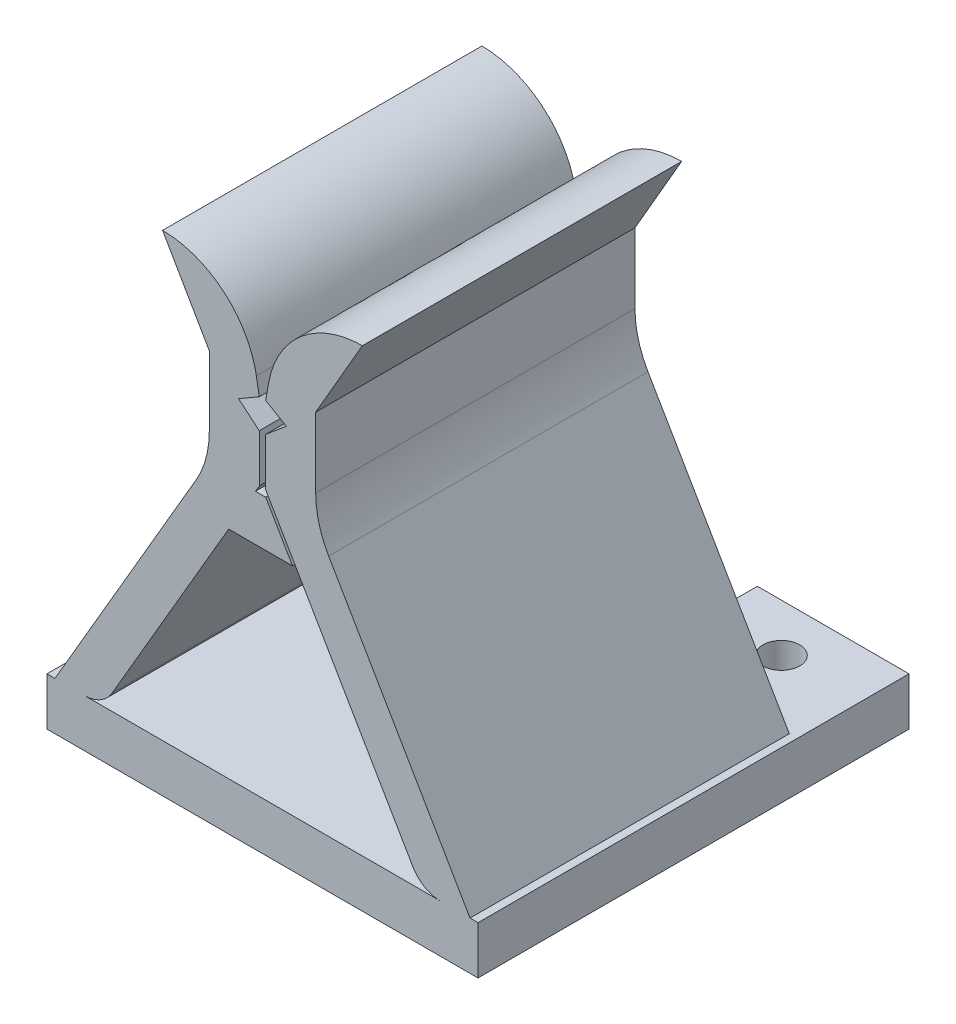
from build123d import *

# Parameters (mm, degrees)
SCHIZZO1_W                     = 50
SCHIZZO1_H                     = 3
ESTRUSIONE_ESTRUSIONE1_DEPTH   = 20
ESTRUSIONE_ESTRUSIONE2_DEPTH   = 20
ESTRUSIONE_ESTRUSIONE2_2_DEPTH = 20
RACCORDO2_R                    = 6
RACCORDO3_DEPTH                = 20
RACCORDO4_R                    = 6
RACCORDO5_R                    = 6
RACCORDO7_R                    = 2
RACCORDO8_R                    = 2
SCHIZZO5_W                     = 11.5
SCHIZZO5_H                     = 20
TAGLIO_ESTRUSIONE2_DEPTH       = 3
ESTRUSIONE_ESTRUSIONE7_DEPTH   = 20
SCHIZZO12_R                    = 1.15
ESTRUSIONE_ESTRUSIONE9_DEPTH   = 3
TAGLIO_ESTRUSIONE4_DEPTH       = 52.461506674
TAGLIO_ESTRUSIONE4_DEPTH_BACK  = 52.461506674


with BuildPart() as part:
    # Schizzo1 → Estrusione-Estrusione1 (new body)
    with BuildSketch(Plane.XY):
        with Locations((25, 1.5)):
            Rectangle(SCHIZZO1_W, SCHIZZO1_H)
    extrude(amount=ESTRUSIONE_ESTRUSIONE1_DEPTH)

    # Schizzo5 → Taglio-Estrusione2 (cut)
    with BuildSketch(Plane(origin=(0, 3, 0), x_dir=(1, 0, 0), z_dir=(0, 1, 0))):
        with Locations((5.75, -10)):
            Rectangle(SCHIZZO5_W, SCHIZZO5_H)
        with Locations((44.25, -10)):
            Rectangle(SCHIZZO5_W, SCHIZZO5_H)
    extrude(amount=-TAGLIO_ESTRUSIONE2_DEPTH, mode=Mode.SUBTRACT)



with BuildPart() as body_2:
    # Schizzo2 → Estrusione-Estrusione2 (new body)
    with BuildSketch(Plane.XY.offset(20)):
        Polygon((12, 3), (21.667680152, 19.610006491), (21.667680152, 25.610006491), (18.742038116, 30.677367142), (23.742038116, 30.677367142), (24.8, 24.677367142), (23.500961894, 23.927367142), (24.8, 22.837344747), (24.8, 19.837344747), (15, 3), align=None)
    extrude(amount=-ESTRUSIONE_ESTRUSIONE2_DEPTH)

    # Raccordo2
    # the kernel refuses this fillet: 6 mm, written as the material it takes off along each edge
    with BuildSketch(Plane(origin=(23.742038116, 30.677367142, 32.586494468), x_dir=(-1, 0, 0), z_dir=(0, 0, -1))) as raccordo2_piece_1:
        with BuildLine():
            CenterArc((RACCORDO2_R * 0.839099631177, -RACCORDO2_R), RACCORDO2_R, 90, 80)
            Line((-RACCORDO2_R * 0.145708121835, -RACCORDO2_R * 0.826351822333), (0, 0))
            Line((0, 0), (RACCORDO2_R * 0.839099631177, 0))
        make_face()
    extrude(amount=45.172988935, mode=Mode.SUBTRACT)

    # Raccordo5
    raccordo5_edges = [body_2.edges().sort_by_distance(p)[0] for p in [
        (21.667680152, 19.610006491, 10),
    ]]
    fillet(raccordo5_edges, radius=RACCORDO5_R)

    # Raccordo8
    raccordo8_edges = [body_2.edges().sort_by_distance(p)[0] for p in [
        (15, 3, 10),
    ]]
    fillet(raccordo8_edges, radius=RACCORDO8_R)

    # Schizzo9 → Estrusione-Estrusione7 (add)
    with BuildSketch(Plane.XY.offset(20)):
        Polygon((24.564100135, 19.432046037), (22.884294771, 16.545978484), (26.884294771, 16.545978484), (25.204489408, 19.432046037), align=None)
    extrude(amount=-ESTRUSIONE_ESTRUSIONE7_DEPTH)


with BuildPart() as body_3:
    # Schizzo2 → Estrusione-Estrusione2 2 (new body)
    with BuildSketch(Plane.XY.offset(20)):
        Polygon((26.499038106, 23.927367142), (25.2, 22.837344747), (25.2, 19.837344747), (35, 3), (38, 3), (28.332319848, 19.610006491), (28.332319848, 25.610006491), (31.257961884, 30.677367142), (26.257961884, 30.677367142), (25.2, 24.677367142), align=None)
    extrude(amount=-ESTRUSIONE_ESTRUSIONE2_2_DEPTH)

    # Raccordo3: read off the stored shape, not the designer's step
    # Raccordo3 outline → Raccordo3 (cut)
    with BuildSketch(Plane.XY):
        with BuildLine():
            add(Edge.make_bspline(
                [(31.257961884, 30.677367142), (26.252870263, 30.648491125), (25.38373076, 25.719356061)],
                knots=[0, 0, 0, 1, 1, 1], degree=2, weights=[1, 0.767895459, 1]))
            Line((31.257961884, 30.677367142), (26.257961884, 30.677367142))
            Line((26.257961884, 30.677367142), (25.38373076, 25.719356061))
        make_face()
    extrude(amount=RACCORDO3_DEPTH, mode=Mode.SUBTRACT)

    # Raccordo4
    raccordo4_edges = [body_3.edges().sort_by_distance(p)[0] for p in [
        (28.332319848, 19.610006491, 10),
    ]]
    fillet(raccordo4_edges, radius=RACCORDO4_R)

    # Raccordo7
    raccordo7_edges = [body_3.edges().sort_by_distance(p)[0] for p in [
        (35, 3, 10),
    ]]
    fillet(raccordo7_edges, radius=RACCORDO7_R)


with BuildPart() as part_1:
    add(part.part)

    add(body_2.part)  # Estrusione-Estrusione9 merges body 2

    add(body_3.part)  # Estrusione-Estrusione9 merges body 3
    # Schizzo12 → Estrusione-Estrusione9 (add)
    with BuildSketch(Plane(origin=(0, 3, 0), x_dir=(1, 0, 0), z_dir=(0, 1, 0))):
        Polygon((11.5, 0), (38.5, 0), (38.5, 7), (29, 7), (21, 7), (11.5, 7), align=None)
        with Locations(Location((16.5, 4, 0), (0, 0, 270))):
            Circle(SCHIZZO12_R, mode=Mode.SUBTRACT)
        with Locations(Location((33.5, 4, 0), (0, 0, 270))):
            Circle(SCHIZZO12_R, mode=Mode.SUBTRACT)
    extrude(amount=-ESTRUSIONE_ESTRUSIONE9_DEPTH)

    # Schizzo13 → Taglio-Estrusione4 (cut, two sides: drawn at the far end of the back side and taken through both)
    with BuildSketch(Plane(origin=(0, 3, 0), x_dir=(1, 0, 0), z_dir=(0, 1, 0)).offset(-TAGLIO_ESTRUSIONE4_DEPTH_BACK)):
        with BuildLine():
            Line((21, 7), (21, 4.031977604))
            ThreePointArc((21, 4.031977604), (25, 0.031977604), (29, 4.031977604))
            Line((29, 4.031977604), (29, 7))
            Line((29, 7), (21, 7))
        make_face()
    extrude(amount=TAGLIO_ESTRUSIONE4_DEPTH + TAGLIO_ESTRUSIONE4_DEPTH_BACK, mode=Mode.SUBTRACT)


solid = part_1.part
